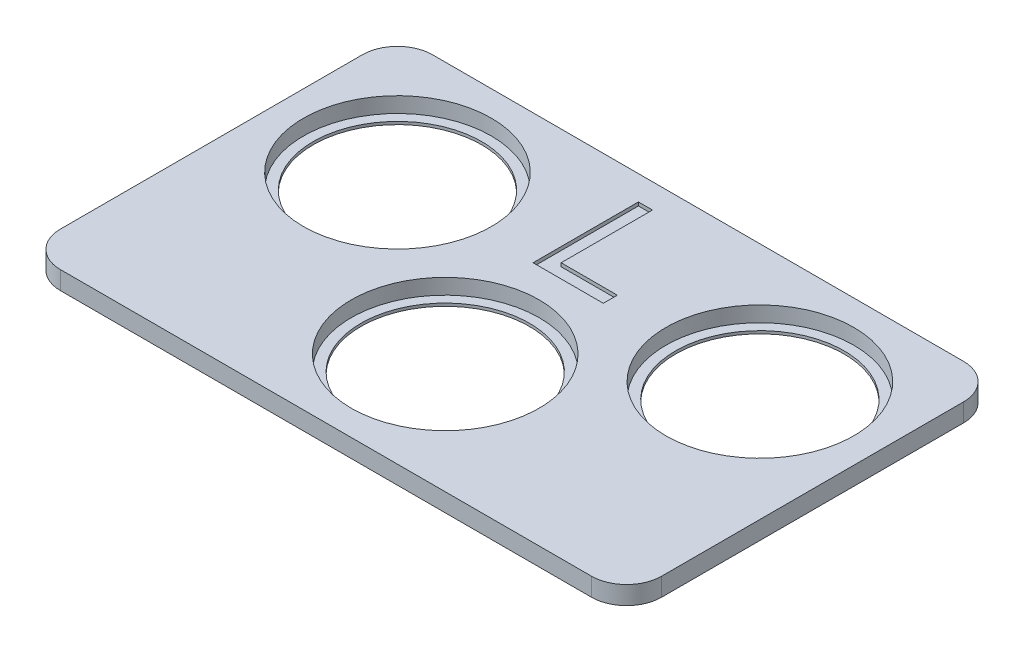
from build123d import *

# Parameters (mm, degrees)
SKETCH1_W           = 85.6
SKETCH1_H           = 52.98
BOSS_EXTRUDE1_DEPTH = 2.6
SKETCH2_R           = 13.375
CUT_EXTRUDE1_DEPTH  = 2.2
SKETCH3_R           = 12
CUT_EXTRUDE2_DEPTH  = 1.75
FILLET1_R           = 5
CUT_EXTRUDE3_DEPTH  = 0.5


with BuildPart() as part:
    # Sketch1 → Boss-Extrude1 (new body)
    with BuildSketch(Plane(origin=(0, 0, 0), x_dir=(1, 0, 0), z_dir=(0, 1, 0))):
        Rectangle(SKETCH1_W, SKETCH1_H)
    extrude(amount=BOSS_EXTRUDE1_DEPTH)

    # Sketch2 → Cut-Extrude1 (cut)
    with BuildSketch(Plane(origin=(0, 2.6, 0), x_dir=(1, 0, 0), z_dir=(0, 1, 0))):
        with Locations((-25.8, 9.49)):
            Circle(SKETCH2_R)
        with Locations((0, -9.51)):
            Circle(SKETCH2_R)
        with Locations((25.8, 9.49)):
            Circle(SKETCH2_R)
    extrude(amount=-CUT_EXTRUDE1_DEPTH, mode=Mode.SUBTRACT)

    # Sketch3 → Cut-Extrude2 (cut)
    with BuildSketch(Plane(origin=(0, 0.4, 0), x_dir=(1, 0, 0), z_dir=(0, 1, 0))):
        with Locations((-25.8, 9.49)):
            Circle(SKETCH3_R)
        with Locations((0, -9.51)):
            Circle(SKETCH3_R)
        with Locations((25.8, 9.49)):
            Circle(SKETCH3_R)
    extrude(amount=-CUT_EXTRUDE2_DEPTH, mode=Mode.SUBTRACT)

    # Fillet1
    fillet1_edges = [part.edges().sort_by_distance(p)[0] for p in [
        (42.8, 1.3, -26.49),
        (42.8, 1.3, 26.49),
        (-42.8, 1.3, 26.49),
        (-42.8, 1.3, -26.49),
    ]]
    fillet(fillet1_edges, radius=FILLET1_R)

    # Sketch4 → Cut-Extrude3 (cut)
    with BuildSketch(Plane(origin=(0, 2.6, 0), x_dir=(1, 0, 0), z_dir=(0, 1, 0))):
        Polygon((5, 10), (-3, 10), (-3, 23), (-5, 23), (-5, 10), (-5, 8), (-3, 8), (5, 8), align=None)
    extrude(amount=-CUT_EXTRUDE3_DEPTH, mode=Mode.SUBTRACT)


solid = part.part
